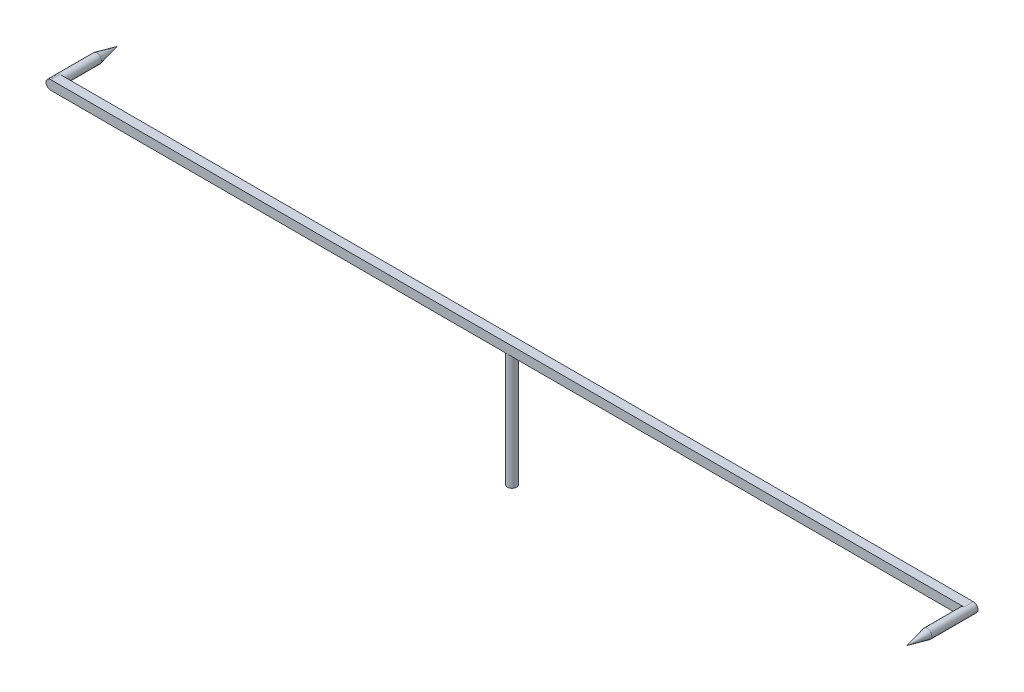
from build123d import *

# Parameters (mm, degrees)
SKETCH_1_R      = 0.4
EXTRUDE_1_DEPTH = 10
SKETCH_2_W      = 80
SKETCH_2_H      = 0.8
EXTRUDE_2_DEPTH = 0.8
FILLET_1_R      = 0.4
SKETCH_3_R      = 0.4
EXTRUDE_3_DEPTH = 3.2
SKETCH_4_R      = 0.4
EXTRUDE_4_DEPTH = 3.2


with BuildPart() as part:
    # 草图1 → 凸台-拉伸1 (new body)
    with BuildSketch(Plane(origin=(0, 0, 0), x_dir=(1, 0, 0), z_dir=(0, 1, 0))):
        with Locations(Location((0, 0, 0), (0, 0, 270))):
            Circle(SKETCH_1_R)
    extrude(amount=EXTRUDE_1_DEPTH)

    # 草图2 → 凸台-拉伸2 (add)
    with BuildSketch(Plane(origin=(0, 10, 0), x_dir=(1, 0, 0), z_dir=(0, 1, 0))):
        Rectangle(SKETCH_2_W, SKETCH_2_H)
    extrude(amount=EXTRUDE_2_DEPTH)

    # 圆角1
    fillet_1_edges = [part.edges().sort_by_distance(p)[0] for p in [
        (40, 10, 0),
        (40, 10.8, 0),
        (-40, 10, 0),
        (-40, 10.8, 0),
    ]]
    fillet(fillet_1_edges, radius=FILLET_1_R - 0.0001)  # a hair under: the kernel refuses the full size

    # 草图3 → 凸台-拉伸3 (add)
    with BuildSketch(Plane.XY.offset(0.4)):
        with Locations((39.6, 10.4)):
            Circle(SKETCH_3_R)
    extrude(amount=EXTRUDE_3_DEPTH)

    # 草图4 → 凸台-拉伸4 (add)
    with BuildSketch(Plane(origin=(0, 0, -0.4), x_dir=(-1, 0, 0), z_dir=(0, 0, -1))):
        with Locations((39.6, 10.4)):
            Circle(SKETCH_4_R)
    extrude(amount=EXTRUDE_4_DEPTH)

    # 草图5 → 旋转1 (revolve)
    with BuildSketch(Plane(origin=(0, 10.4, 0), x_dir=(1, 0, 0), z_dir=(0, 1, 0))):
        Polygon((39.6, -3.6), (39.6, -5.4), (40, -3.6), align=None)
    revolve(axis=Axis((39.6, 10.4, 3.6), (0, 0, 1)))

    # 草图6 → 旋转2 (revolve)
    with BuildSketch(Plane(origin=(0, 10.4, 0), x_dir=(1, 0, 0), z_dir=(0, 1, 0))):
        Polygon((-39.6, 3.6), (-39.6, 5.4), (-40, 3.6), align=None)
    revolve(axis=Axis((-39.6, 10.4, -3.6), (0, 0, -1)))


solid = part.part
